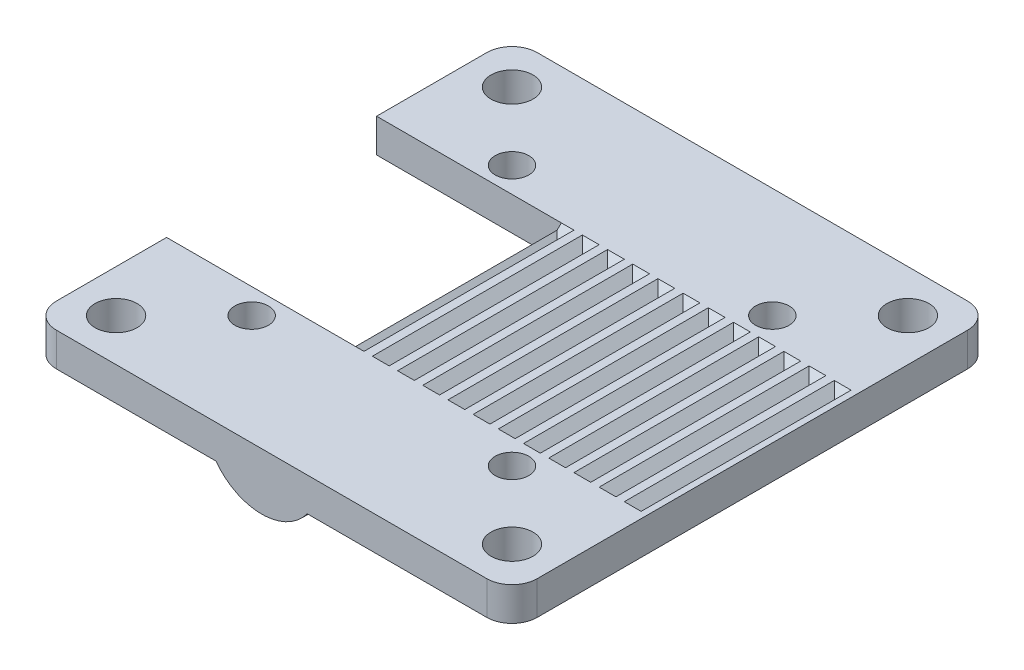
from build123d import *

# Parameters (mm, degrees)
SKETCH1_R              = 2
SKETCH1_R_2            = 2.5
BOSS_EXTRUDE1_DEPTH    = 4
CUT_EXTRUDE2_DEPTH     = 23
CHAMFER2_SIZE          = 1
CUT_EXTRUDE3_START     = -4
CUT_EXTRUDE3_OUTLINE_W = 22
CUT_EXTRUDE3_OUTLINE_H = 25
CUT_EXTRUDE3_DEPTH     = 4
BOSS_EXTRUDE2_REACH    = 66.132


# Read off the part's stored shape, not the designer's step: Cut-Extrude3
with BuildPart() as part:
    # Sketch1 → Boss-Extrude1 (new body)
    with BuildSketch(Plane(origin=(0, 0, 0), x_dir=(1, 0, 0), z_dir=(0, 1, 0))):
        with BuildLine():
            Line((25.625, 28.625), (-25.625, 28.625))
            ThreePointArc((-25.625, 28.625), (-27.746320344, 27.746320344), (-28.625, 25.625))
            Line((-28.625, 25.625), (-28.625, -25.625))
            ThreePointArc((-28.625, -25.625), (-27.746320344, -27.746320344), (-25.625, -28.625))
            Line((-25.625, -28.625), (25.625, -28.625))
            ThreePointArc((25.625, -28.625), (27.746320344, -27.746320344), (28.625, -25.625))
            Line((28.625, -25.625), (28.625, 25.625))
            ThreePointArc((28.625, 25.625), (27.746320344, 27.746320344), (25.625, 28.625))
        make_face()
        with Locations(Location((-15.5, 15.5, 0), (0, 0, 270))):
            Circle(SKETCH1_R, mode=Mode.SUBTRACT)
        with Locations(Location((-23.57, 23.57, 0), (0, 0, 270))):
            Circle(SKETCH1_R_2, mode=Mode.SUBTRACT)
        with Locations(Location((23.57, 23.57, 0), (0, 0, 270))):
            Circle(SKETCH1_R_2, mode=Mode.SUBTRACT)
        with Locations(Location((15.5, 15.5, 0), (0, 0, 270))):
            Circle(SKETCH1_R, mode=Mode.SUBTRACT)
        with Locations(Location((15.5, -15.5, 0), (0, 0, 270))):
            Circle(SKETCH1_R, mode=Mode.SUBTRACT)
        with Locations(Location((-15.5, -15.5, 0), (0, 0, 270))):
            Circle(SKETCH1_R, mode=Mode.SUBTRACT)
        with Locations(Location((-23.57, -23.57, 0), (0, 0, 270))):
            Circle(SKETCH1_R_2, mode=Mode.SUBTRACT)
        with Locations(Location((23.57, -23.57, 0), (0, 0, 270))):
            Circle(SKETCH1_R_2, mode=Mode.SUBTRACT)
    extrude(amount=BOSS_EXTRUDE1_DEPTH)

    # Sketch3 → Cut-Extrude2 (cut)
    with BuildSketch(Plane.XY.offset(11.5)):
        Polygon((-28.125, 4), (-27.125, 3), (-26.125, 4), align=None)
        Polygon((-25.125, 4), (-24.125, 3), (-23.125, 4), align=None)
        Polygon((-22.125, 4), (-21.125, 3), (-20.125, 4), align=None)
        Polygon((-19.125, 4), (-18.125, 3), (-17.125, 4), align=None)
        Polygon((-16.125, 4), (-15.125, 3), (-14.125, 4), align=None)
        Polygon((-13.125, 4), (-12.125, 3), (-11.125, 4), align=None)
        Polygon((-10.125, 4), (-9.125, 3), (-8.125, 4), align=None)
        Polygon((-7.125, 4), (-6.125, 3), (-5.125, 4), align=None)
        Polygon((-4.125, 4), (-3.125, 3), (-2.125, 4), align=None)
        Polygon((-1.125, 4), (-0.125, 3), (0.875, 4), align=None)
        Polygon((1.875, 4), (2.875, 3), (3.875, 4), align=None)
        Polygon((4.875, 4), (5.875, 3), (6.875, 4), align=None)
        Polygon((7.875, 4), (8.875, 3), (9.875, 4), align=None)
        Polygon((10.875, 4), (11.875, 3), (12.875, 4), align=None)
        Polygon((13.875, 4), (14.875, 3), (15.875, 4), align=None)
        Polygon((16.875, 4), (17.875, 3), (18.875, 4), align=None)
        Polygon((19.875, 4), (20.875, 3), (21.875, 4), align=None)
        Polygon((22.875, 4), (23.875, 3), (24.875, 4), align=None)
        Polygon((25.875, 4), (26.875, 3), (27.875, 4), align=None)
    extrude(amount=-CUT_EXTRUDE2_DEPTH, mode=Mode.SUBTRACT)

    # Chamfer2
    chamfer2_edges = [part.edges().sort_by_distance(p)[0] for p in [
        (26.875, 4, -11.5),
        (23.875, 4, -11.5),
        (20.875, 4, -11.5),
        (17.875, 4, -11.5),
        (14.875, 4, -11.5),
        (11.875, 4, -11.5),
        (8.875, 4, -11.5),
        (5.875, 4, -11.5),
        (2.875, 4, -11.5),
        (-0.125, 4, -11.5),
        (-3.125, 4, -11.5),
        (-6.125, 4, -11.5),
        (-9.125, 4, -11.5),
        (-12.125, 4, -11.5),
        (-15.125, 4, -11.5),
        (-18.125, 4, -11.5),
        (-21.125, 4, -11.5),
        (-24.125, 4, -11.5),
        (-27.125, 4, -11.5),
        (26.875, 4, 11.5),
        (23.875, 4, 11.5),
        (20.875, 4, 11.5),
        (17.875, 4, 11.5),
        (14.875, 4, 11.5),
        (11.875, 4, 11.5),
        (8.875, 4, 11.5),
        (5.875, 4, 11.5),
        (2.875, 4, 11.5),
        (-0.125, 4, 11.5),
        (-3.125, 4, 11.5),
        (-6.125, 4, 11.5),
        (-9.125, 4, 11.5),
        (-12.125, 4, 11.5),
        (-15.125, 4, 11.5),
        (-18.125, 4, 11.5),
        (-21.125, 4, 11.5),
        (-24.125, 4, 11.5),
        (-27.125, 4, 11.5),
    ]]
    chamfer(chamfer2_edges, length=CHAMFER2_SIZE - 0.0001)  # a hair under: the kernel refuses the full size

    # Cut-Extrude3 outline → Cut-Extrude3 (cut)
    with BuildSketch(Plane.XZ.offset(CUT_EXTRUDE3_START)):
        with Locations((-17.625, 0)):
            Rectangle(CUT_EXTRUDE3_OUTLINE_W, CUT_EXTRUDE3_OUTLINE_H)
    extrude(amount=CUT_EXTRUDE3_DEPTH, mode=Mode.SUBTRACT)

    # Boss-Extrude2: up to this face of the body (flat: up to its plane)
    boss_extrude2_end = Plane(part.part.faces().sort_by_distance((0, 2, 28.625))[0])
    # Sketch5 → Boss-Extrude2 (add, up to the picked face)
    with BuildSketch(Plane(origin=(0, 0, -28.625), x_dir=(-1, 0, 0), z_dir=(0, 0, -1)), mode=Mode.PRIVATE) as boss_extrude2_sk1:
        with BuildLine():
            Line((6.625, 0), (-4.249281585, 0))
            ThreePointArc((-4.249281585, 0), (1.187859207, -2.75), (6.625, 0))
        make_face()
    boss_extrude2_tool1 = split(extrude(boss_extrude2_sk1.sketch, amount=-BOSS_EXTRUDE2_REACH, mode=Mode.PRIVATE), bisect_by=boss_extrude2_end, keep=Keep.BOTH, mode=Mode.PRIVATE)
    add(boss_extrude2_tool1.solids().sort_by(Axis((-1.187859, -1.121798, -28.625), (0, 0, 1)))[0])


solid = part.part
